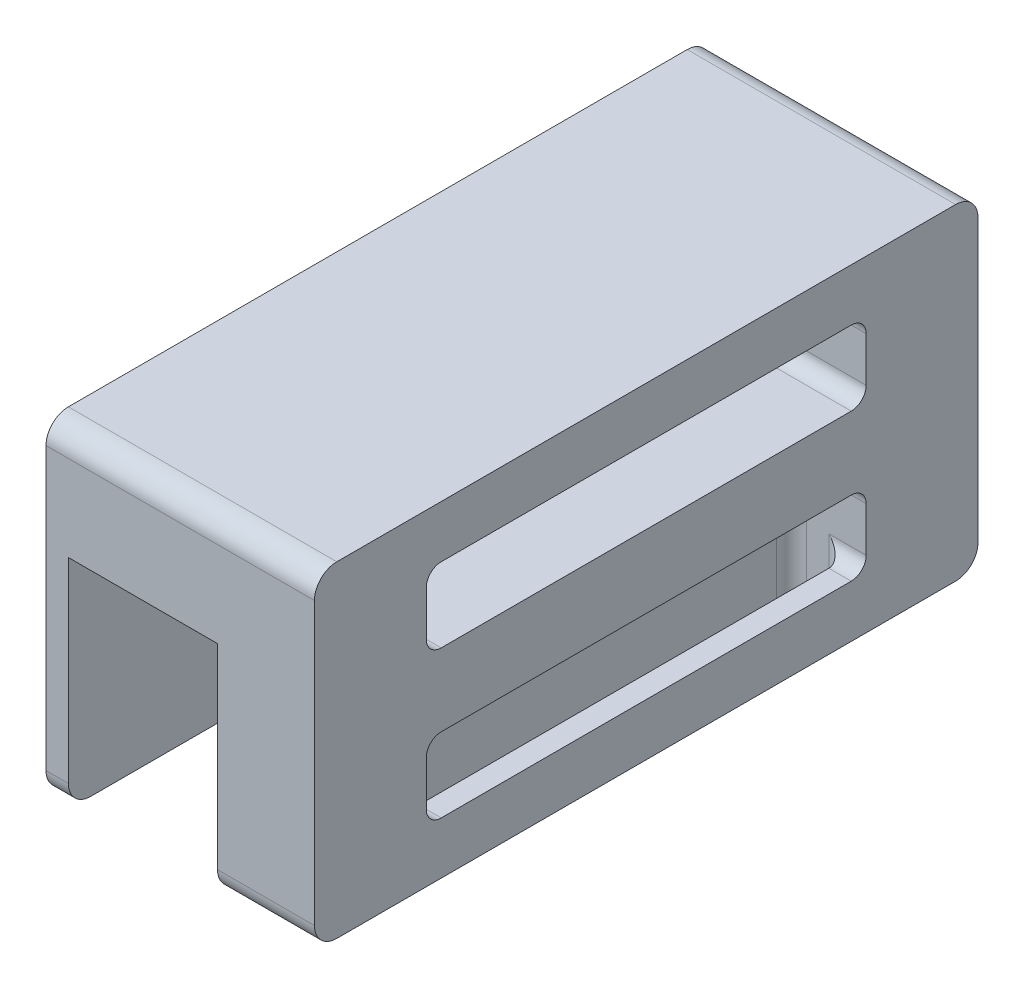
from build123d import *

# Parameters (mm, degrees)
RESSALTO_EXTRUS_O2_DEPTH      = 30
RESSALTO_EXTRUS_O3_START      = 3
RESSALTO_EXTRUS_O3_DEPTH      = 3
RESSALTO_EXTRUS_O4_DEPTH      = 3
RESSALTO_EXTRUS_O4_DEPTH_BACK = 10
CORTE_EXTRUS_O1_DEPTH         = 10.000000000000002
CORTE_EXTRUS_O2_REACH         = 83.702
FILETE1_R                     = 2


with BuildPart() as part:
    # Esboço2 → Ressalto-extrusão2 (new body)
    with BuildSketch(Plane(origin=(0, 0, 0), x_dir=(0, 0, -1), z_dir=(1, 0, 0))):
        with BuildLine():
            Line((2.901599919865161, -0.06246593766177921), (-35.09840008013481, -0.06246593766176534))
            Line((-35.09840008013481, -0.06246593766176534), (-39.886084902926825, -0.06246593766177921))
            ThreePointArc((-39.886084902926825, -0.06246593766177921), (-45.20218023363878, 1.4676385237390175), (-48.891439327799866, 5.589707975381692))
            ThreePointArc((-48.891439327799866, 5.589707975381692), (-52.09653694789475, 9.772081498832542), (-56.69840008013493, 12.338743680758546))
            ThreePointArc((-56.69840008013493, 12.338743680758546), (-59.37322401506481, 11.895603400997262), (-60.5984000801349, 9.476926076507686))
            Line((-60.5984000801349, 9.476926076507686), (-60.598400080134894, 20.976926076507663))
            ThreePointArc((-60.598400080134894, 20.976926076507663), (-59.71972042369454, 23.098246420067323), (-57.59840008013488, 23.976926076507684))
            Line((-57.59840008013488, 23.976926076507684), (25.401599919865156, 23.976926076507684))
            ThreePointArc((25.401599919865156, 23.976926076507684), (27.522920263424812, 23.098246420067333), (28.401599919865177, 20.976926076507684))
            Line((28.401599919865177, 20.976926076507684), (28.40159991986526, 9.476926076507686))
            ThreePointArc((28.40159991986526, 9.476926076507686), (27.176423854795164, 11.895603400997262), (24.50159991986529, 12.338743680758546))
            ThreePointArc((24.50159991986529, 12.338743680758546), (19.8997367876251, 9.772081498832549), (16.69463916753021, 5.589707975381692))
            ThreePointArc((16.69463916753021, 5.589707975381692), (13.005380073369123, 1.467638523739021), (7.689284742657176, -0.06246593766177921))
            Line((7.689284742657176, -0.06246593766177921), (2.901599919865161, -0.06246593766177921))
        make_face()
    extrude(amount=RESSALTO_EXTRUS_O2_DEPTH)

    # Esboço3 → Ressalto-extrusão3 (add)
    with BuildSketch(Plane.ZY.offset(RESSALTO_EXTRUS_O3_START)):
        with BuildLine():
            Line((60.598400080134894, 15.226926076507677), (60.59840008013489, 20.976926076507663))
            ThreePointArc((60.59840008013489, 20.976926076507663), (59.71972042369454, 23.098246420067326), (57.59840008013487, 23.976926076507684))
            Line((57.59840008013487, 23.976926076507684), (16.09840008013486, 23.976926076507684))
            Line((16.09840008013486, 23.976926076507684), (-25.4015999198652, 23.976926076507684))
            ThreePointArc((-25.4015999198652, 23.976926076507684), (-27.52292026342486, 23.098246420067326), (-28.40159991986522, 20.976926076507663))
            Line((-28.40159991986522, 20.976926076507663), (-28.40159991986522, 15.226926076507686))
            Line((-28.40159991986522, 15.226926076507686), (-28.40159991986525, -16.773073923492294))
            ThreePointArc((-28.40159991986525, -16.773073923492294), (-27.522920263424897, -18.894394267051958), (-25.401599919865234, -19.77307392349232))
            Line((-25.401599919865234, -19.77307392349232), (57.59840008013488, -19.773073923492326))
            ThreePointArc((57.59840008013488, -19.773073923492326), (59.71972042369455, -18.89439426705197), (60.5984000801349, -16.7730739234923))
            Line((60.5984000801349, -16.7730739234923), (60.598400080134894, 15.226926076507677))
        make_face()
    extrude(amount=-RESSALTO_EXTRUS_O3_DEPTH)

    # Esboço4 → Ressalto-extrusão4 (add, two sides: drawn at the far end of the back side and taken through both)
    with BuildSketch(Plane(origin=(30, 0, 0), x_dir=(0, 0, -1), z_dir=(1, 0, 0)).offset(-RESSALTO_EXTRUS_O4_DEPTH_BACK)):
        with BuildLine():
            Line((-16.09840008013486, 23.976926076507684), (25.4015999198652, 23.976926076507684))
            ThreePointArc((25.4015999198652, 23.976926076507684), (27.52292026342486, 23.098246420067326), (28.40159991986522, 20.976926076507663))
            Line((28.40159991986522, 20.976926076507663), (28.40159991986522, 15.226926076507686))
            Line((28.40159991986522, 15.226926076507686), (28.40159991986523, -16.773073923492294))
            ThreePointArc((28.40159991986523, -16.773073923492294), (27.522920263424872, -18.89439426705196), (25.401599919865205, -19.77307392349232))
            Line((25.401599919865205, -19.77307392349232), (-57.598400080134866, -19.773073923492326))
            ThreePointArc((-57.598400080134866, -19.773073923492326), (-59.71972042369453, -18.89439426705197), (-60.59840008013489, -16.773073923492305))
            Line((-60.59840008013489, -16.773073923492305), (-60.598400080134894, 15.226926076507677))
            Line((-60.598400080134894, 15.226926076507677), (-60.598400080134894, 20.976926076507663))
            ThreePointArc((-60.598400080134894, 20.976926076507663), (-59.71972042369454, 23.098246420067326), (-57.59840008013487, 23.976926076507684))
            Line((-57.59840008013487, 23.976926076507684), (-16.09840008013486, 23.976926076507684))
        make_face()
    extrude(amount=RESSALTO_EXTRUS_O4_DEPTH + RESSALTO_EXTRUS_O4_DEPTH_BACK)

    # Esboço8 → Corte-extrusão1 (cut)
    with BuildSketch(Plane(origin=(33, 0, 0), x_dir=(0, 0, -1), z_dir=(1, 0, 0))):
        with BuildLine():
            Line((-43.59840008013488, -2.7730739234923267), (11.401599919865212, -2.7730739234923267))
            ThreePointArc((11.401599919865212, -2.7730739234923267), (12.815813482238323, -3.3588603611192323), (13.401599919865227, -4.7730739234923405))
            Line((13.401599919865227, -4.7730739234923405), (13.401599919865227, -10.773073923492314))
            ThreePointArc((13.401599919865227, -10.773073923492314), (12.81581348223832, -12.187287485865422), (11.401599919865212, -12.773073923492326))
            Line((11.401599919865212, -12.773073923492326), (-43.59840008013488, -12.773073923492326))
            ThreePointArc((-43.59840008013488, -12.773073923492326), (-45.012613642507986, -12.187287485865422), (-45.598400080134894, -10.773073923492314))
            Line((-45.598400080134894, -10.773073923492314), (-45.598400080134894, -4.7730739234923405))
            ThreePointArc((-45.598400080134894, -4.7730739234923405), (-45.012613642507986, -3.358860361119232), (-43.59840008013488, -2.7730739234923267))
        make_face()
        with BuildLine():
            Line((-43.59840008013488, 6.976926076507685), (11.401599919865218, 6.976926076507685))
            ThreePointArc((11.401599919865218, 6.976926076507685), (12.815813482238326, 7.56271251413459), (13.401599919865228, 8.976926076507699))
            Line((13.401599919865228, 8.976926076507699), (13.401599919865227, 14.976926076507674))
            ThreePointArc((13.401599919865227, 14.976926076507674), (12.81581348223832, 16.39113963888078), (11.401599919865214, 16.976926076507684))
            Line((11.401599919865214, 16.976926076507684), (-43.59840008013488, 16.976926076507684))
            ThreePointArc((-43.59840008013488, 16.976926076507684), (-45.012613642507986, 16.39113963888078), (-45.598400080134894, 14.976926076507672))
            Line((-45.598400080134894, 14.976926076507672), (-45.598400080134894, 8.976926076507699))
            ThreePointArc((-45.598400080134894, 8.976926076507699), (-45.012613642507986, 7.5627125141345894), (-43.59840008013488, 6.976926076507685))
        make_face()
    extrude(amount=-CORTE_EXTRUS_O1_DEPTH, mode=Mode.SUBTRACT)

    # Esboço9 → Corte-extrusão2 (cut, up to next)
    with BuildSketch(Plane(origin=(0, -19.773073923492323, -1.65e-15), x_dir=(-1, 0, 0), z_dir=(0, -1, -8e-17)), mode=Mode.PRIVATE) as corte_extrus_o2_sk1:
        with BuildLine():
            Line((-25.000000000000007, 13.401599919865228), (-27.99999999999999, 13.401599919865228))
            ThreePointArc((-27.99999999999999, 13.401599919865228), (-29.414213562373096, 12.815813482238323), (-30.000000000000004, 11.401599919865216))
            Line((-30.000000000000004, 11.401599919865216), (-29.999999999999996, -43.59840008013487))
            ThreePointArc((-29.999999999999996, -43.59840008013487), (-29.414213562373092, -45.01261364250798), (-27.999999999999982, -45.59840008013489))
            Line((-27.999999999999982, -45.59840008013489), (-25, -45.59840008013489))
            ThreePointArc((-25, -45.59840008013489), (-23.585786437626894, -45.01261364250798), (-22.99999999999999, -43.59840008013487))
            Line((-22.99999999999999, -43.59840008013487), (-22.999999999999996, 11.401599919865216))
            ThreePointArc((-22.999999999999996, 11.401599919865216), (-23.585786437626897, 12.815813482238324), (-25.000000000000007, 13.401599919865228))
        make_face()
    corte_extrus_o2_tool1 = extrude(corte_extrus_o2_sk1.sketch, amount=-CORTE_EXTRUS_O2_REACH, mode=Mode.PRIVATE) & part.part
    add(corte_extrus_o2_tool1.solids().sort_by_distance((26.5, -19.773074, 16.0984))[0], mode=Mode.SUBTRACT)

    # Filete1
    # the kernel refuses this fillet: 2 mm, written as the material it adds along each edge
    with BuildSketch(Plane(origin=(22.99999999999999, -15.773073923492316, 45.59840008013489), x_dir=(0, 0, -1), z_dir=(0, 1, 0))) as filete1_piece_1:
        with BuildLine():
            CenterArc((FILETE1_R, -FILETE1_R), FILETE1_R, 90, 90)
            Line((0, -FILETE1_R), (0, 0))
            Line((0, 0), (FILETE1_R, 0))
        make_face()
    extrude(amount=10.999999999999973)
    with BuildSketch(Plane(origin=(23, -4.773073923492332, 43.59840008013489), x_dir=(0, -4.44e-15, 1), z_dir=(0, -1, -4.44e-15))) as filete1_piece_2:
        with BuildLine():
            CenterArc((2.000000000000007 - FILETE1_R, -FILETE1_R), FILETE1_R, 359.9999999999997, 90.00000000000028)
            Line((2.000000000000007, -FILETE1_R), (2.000000000000007, 0))
            Line((2.000000000000007, 0), (2.000000000000007 - FILETE1_R, 1.066e-14))
        make_face()
    revolve(axis=Axis((23, -4.773073923492332, 43.59840008013489), (-1, 0, 0)), revolution_arc=90.00000000000045)
    with BuildSketch(Plane(origin=(23, -2.7730739234923267, 43.59840008013488), x_dir=(-5.33e-15, -1, 0), z_dir=(0, 0, -1))) as filete1_piece_3:
        with BuildLine():
            CenterArc((FILETE1_R, -FILETE1_R), FILETE1_R, 89.99999999999969, 90.00000000000031)
            Line((-1.11e-14, -FILETE1_R), (0, 0))
            Line((0, 0), (FILETE1_R, 0))
        make_face()
    extrude(amount=55.00000000000009)
    with BuildSketch(Plane(origin=(23, -4.773073923492328, -11.401599919865227), x_dir=(0, 1, 7.11e-15), z_dir=(0, -7.11e-15, 1))) as filete1_piece_4:
        with BuildLine():
            CenterArc((2.0000000000000004 - FILETE1_R, -FILETE1_R), FILETE1_R, 359.9999999999999, 90.00000000000011)
            Line((2.0000000000000018, -FILETE1_R), (2.0000000000000004, 0))
            Line((2.0000000000000004, 0), (2.0000000000000004 - FILETE1_R, 3.55e-15))
        make_face()
    revolve(axis=Axis((23, -4.773073923492328, -11.401599919865227), (-1, 0, 0)), revolution_arc=90.00000000000077)
    with BuildSketch(Plane(origin=(23, -4.7730739234923405, -13.401599919865227), x_dir=(-1.78e-15, 0, 1), z_dir=(0, -1, 0))) as filete1_piece_5:
        with BuildLine():
            CenterArc((FILETE1_R, -FILETE1_R), FILETE1_R, 89.9999999999999, 90.0000000000001)
            Line((-3.55e-15, -FILETE1_R), (0, 0))
            Line((0, 0), (FILETE1_R, 0))
        make_face()
    extrude(amount=10.999999999999973)


solid = part.part
